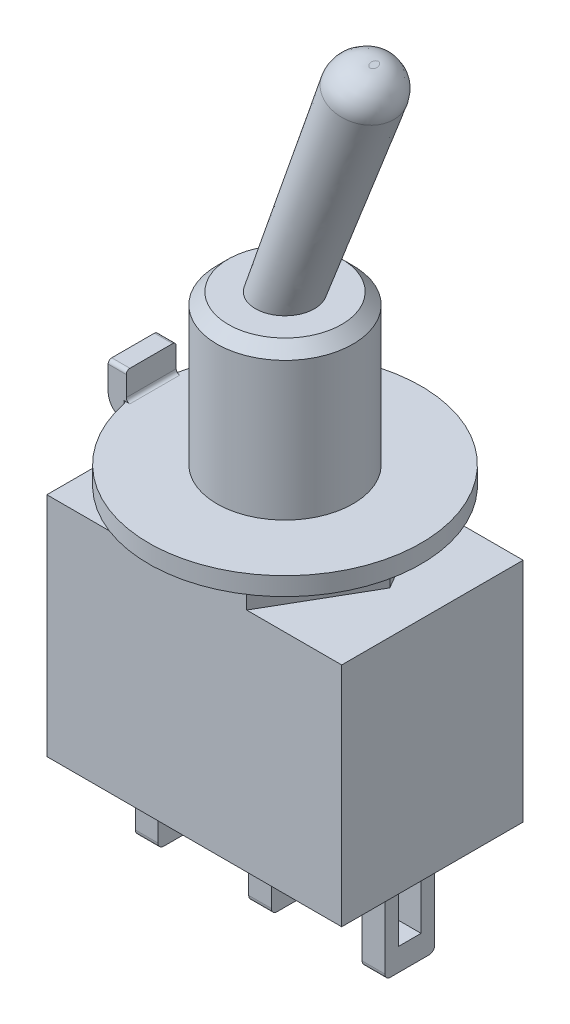
from build123d import *

# Parameters (mm, degrees)
SKETCH_1_W               = 13
SKETCH_1_H               = 8
EXTRUDE_1_DEPTH          = 10
SKETCH_2_W               = 1
SKETCH_2_H               = 2.2
EXTRUDE_2_DEPTH          = 4
FILLET_1_R               = 0.25
CUT_EXTRUDE_1_DEPTH      = 17.124515497
CUT_EXTRUDE_1_DEPTH_BACK = 17.124515497
SKETCH_3_W               = 1
SKETCH_3_H               = 2
SKETCH_4_R               = 3
EXTRUDE_3_DEPTH          = 9
SKETCH_5_R               = 3
EXTRUDE_4_DEPTH          = 1.6
CHAMFER_1_SIZE           = 0.5
EXTRUDE_5_DEPTH          = 0.8
SKETCH_7_W               = 0.8
SKETCH_7_H               = 2.2
EXTRUDE_6_DEPTH          = 1.2
FILLET_2_R               = 0.8
FILLET_3_R               = 0.16
FILLET_4_R               = 0.16
SKETCH_9_R               = 1.5
SKETCH_8_R               = 1.3
SKETCH_12_W              = 4.669738192
SKETCH_12_H              = 4.390198151
CUT_EXTRUDE_2_DEPTH      = 36.72966294
FILLET_5_R               = 1.25


with BuildPart() as part:
    # Эскиз1 → Бобышка-Вытянуть1 (new body)
    with BuildSketch(Plane(origin=(0, 0, 0), x_dir=(1, 0, 0), z_dir=(0, 1, 0))):
        Rectangle(SKETCH_1_W, SKETCH_1_H)
    extrude(amount=EXTRUDE_1_DEPTH)

    # Эскиз2 → Бобышка-Вытянуть2 (add)
    with BuildSketch(Plane.XZ):
        Rectangle(SKETCH_2_W, SKETCH_2_H)
        with Locations((-5, 0)):
            Rectangle(SKETCH_2_W, SKETCH_2_H)
        with Locations((5, 0)):
            Rectangle(SKETCH_2_W, SKETCH_2_H)
    extrude(amount=EXTRUDE_2_DEPTH)

    # Скругление1
    fillet_1_edges = [part.edges().sort_by_distance(p)[0] for p in [
        (-5, -4, 1.1),
        (-5, -4, -1.1),
        (0, -4, 1.1),
        (0, -4, -1.1),
        (5, -4, 1.1),
        (5, -4, -1.1),
    ]]
    fillet(fillet_1_edges, radius=FILLET_1_R)

    # Эскиз3 → Вырез-Вытянуть1 (cut, two sides: drawn at the far end of the back side and taken through both)
    with BuildSketch(Plane(origin=(5.5, 0, 0), x_dir=(0, 0, -1), z_dir=(1, 0, 0)).offset(-CUT_EXTRUDE_1_DEPTH_BACK)):
        with Locations((0, -2)):
            Rectangle(SKETCH_3_W, SKETCH_3_H)
    extrude(amount=CUT_EXTRUDE_1_DEPTH + CUT_EXTRUDE_1_DEPTH_BACK, mode=Mode.SUBTRACT)

    # Эскиз4 → Бобышка-Вытянуть3 (add)
    with BuildSketch(Plane(origin=(0, 10, 0), x_dir=(1, 0, 0), z_dir=(0, 1, 0))):
        with Locations(Location((0, 0, 0), (0, 0, 270))):
            Circle(SKETCH_4_R)
    extrude(amount=EXTRUDE_3_DEPTH)

    # Эскиз5 → Бобышка-Вытянуть4 (add)
    with BuildSketch(Plane(origin=(0, 10, 0), x_dir=(1, 0, 0), z_dir=(0, 1, 0))):
        Polygon((-4.618802154, 0), (-2.309401077, -4), (2.309401077, -4), (4.618802154, 0), (2.309401077, 4), (-2.309401077, 4), align=None)
        with Locations(Location((0, 0, 0), (0, 0, 270))):
            Circle(SKETCH_5_R, mode=Mode.SUBTRACT)
    extrude(amount=EXTRUDE_4_DEPTH)

    # Фаска1
    chamfer_1_edges = [part.edges().sort_by_distance(p)[0] for p in [
        (0, 19, -3),
    ]]
    chamfer(chamfer_1_edges, length=CHAMFER_1_SIZE)

    # Эскиз6 → Бобышка-Вытянуть5 (add)
    with BuildSketch(Plane(origin=(0, 11.6, 0), x_dir=(1, 0, 0), z_dir=(0, 1, 0))):
        with BuildLine():
            Line((-5.898304841, 1.1), (-6.698304841, 1.1))
            Line((-6.698304841, 1.1), (-6.698304841, -1.1))
            Line((-6.698304841, -1.1), (-5.898304841, -1.1))
            ThreePointArc((-5.898304841, -1.1), (6, 0), (-5.898304841, 1.1))
        make_face()
    extrude(amount=EXTRUDE_5_DEPTH)

    # Эскиз7 → Бобышка-Вытянуть6 (add)
    with BuildSketch(Plane(origin=(0, 12.4, 0), x_dir=(1, 0, 0), z_dir=(0, 1, 0))):
        with Locations((-6.298304841, 0)):
            Rectangle(SKETCH_7_W, SKETCH_7_H)
    extrude(amount=EXTRUDE_6_DEPTH)

    # Скругление2
    fillet_2_edges = [part.edges().sort_by_distance(p)[0] for p in [
        (-6.698304841, 11.6, 0),
    ]]
    fillet(fillet_2_edges, radius=FILLET_2_R)

    # Скругление3
    # the kernel refuses this fillet: 0.16 mm, written as the material it adds along each edge
    with BuildSketch(Plane(origin=(-5.898304841, 11.6, 1.1), x_dir=(0.19395072927353899, 0, 0.981011271400213), z_dir=(0, 1, 0))) as fillet_3_piece_1_section:
        with BuildLine():
            CenterArc((0.131466071, -0.159990649), FILLET_3_R, 90.619457051, 78.19710831)
            Line((-0.025495733, -0.128958532), (0, 0))
            ThreePointArc((0, 0), (0.064868127, -0.000350666), (0.129736254, 0))
        make_face()
    fillet_3_piece_1 = extrude(amount=0.8, mode=Mode.PRIVATE)
    fillet_3_piece_1 = split(fillet_3_piece_1, bisect_by=Plane(origin=(-5.898304841, 11.6, 1.1), z_dir=(1, 0, 0)), keep=Keep.TOP, mode=Mode.PRIVATE)
    add(fillet_3_piece_1)
    with BuildSketch(Plane(origin=(-5.898304841, 11.271363276, 1.1), x_dir=(0.19395072927353899, 0, 0.981011271400213), z_dir=(0, 1, 0))) as fillet_3_piece_2_section:
        with BuildLine():
            CenterArc((0.131466071, -0.159990649), FILLET_3_R, 90.619457051, 78.19710831)
            Line((-0.025495733, -0.128958532), (0, 0))
            ThreePointArc((0, 0), (0.064868127, -0.000350666), (0.129736254, 0))
        make_face()
    fillet_3_piece_2 = extrude(amount=1.128636724, mode=Mode.PRIVATE)
    fillet_3_piece_2 = fillet_3_piece_2 & Plane(origin=(-5.898304841, 12.4, 1.1), x_dir=(0, -1, 0), z_dir=(0, 0, 1)) * Cylinder(0.8, 3, mode=Mode.PRIVATE)
    add(fillet_3_piece_2)
    with BuildSketch(Plane(origin=(-5.898304841, 11.6, -1.1), x_dir=(0.19395072927353899, 0, -0.981011271400213), z_dir=(0, 1, 0))) as fillet_3_piece_3_section:
        with BuildLine():
            CenterArc((0.131466071, 0.159990649), FILLET_3_R, 191.18343464, 78.19710831)
            Line((-0.025495733, 0.128958532), (0, 0))
            ThreePointArc((0, 0), (0.064868127, 0.000350666), (0.129736254, 0))
        make_face()
    fillet_3_piece_3 = extrude(amount=0.8, mode=Mode.PRIVATE)
    fillet_3_piece_3 = split(fillet_3_piece_3, bisect_by=Plane(origin=(-5.898304841, 11.6, -1.1), z_dir=(1, 0, 0)), keep=Keep.TOP, mode=Mode.PRIVATE)
    add(fillet_3_piece_3)
    with BuildSketch(Plane(origin=(-5.898304841, 11.271363276, -1.1), x_dir=(0.19395072927353899, 0, -0.981011271400213), z_dir=(0, 1, 0))) as fillet_3_piece_4_section:
        with BuildLine():
            CenterArc((0.131466071, 0.159990649), FILLET_3_R, 191.18343464, 78.19710831)
            Line((-0.025495733, 0.128958532), (0, 0))
            ThreePointArc((0, 0), (0.064868127, 0.000350666), (0.129736254, 0))
        make_face()
    fillet_3_piece_4 = extrude(amount=1.128636724, mode=Mode.PRIVATE)
    fillet_3_piece_4 = fillet_3_piece_4 & Plane(origin=(-5.898304841, 12.4, -1.1), x_dir=(0, -1, 0), z_dir=(0, 0, 1)) * Cylinder(0.8, 3, mode=Mode.PRIVATE)
    add(fillet_3_piece_4)

    # Скругление4
    fillet_4_edges = [part.edges().sort_by_distance(p)[0] for p in [
        (-5.898304841, 12.4, 0),
        (-6.298304841, 13.6, 1.1),
        (-6.298304841, 13.6, -1.1),
    ]]
    fillet(fillet_4_edges, radius=FILLET_4_R)

    # Эскиз9 → По сечениям1 section 0
    with BuildSketch(Plane(origin=(0, 30, 0), x_dir=(1, 0, 0), z_dir=(0, 1, 0))):
        with Locations((4, 0.137410302)):
            Circle(SKETCH_9_R)
    # Эскиз8 → По сечениям1 section 1
    with BuildSketch(Plane(origin=(0, 19, 0), x_dir=(1, 0, 0), z_dir=(0, 1, 0))):
        Circle(SKETCH_8_R)
    loft()

    # Эскиз12 → Вырез-Вытянуть2 (cut, through all)
    with BuildSketch(Plane(origin=(2.5, 30, 0), x_dir=(0.939793423488437, -0.3417430630867046, 0), z_dir=(0.3417430630867046, 0.9397934234884371, 0))):
        with Locations((1.683707955, 0.058821328)):
            Rectangle(SKETCH_12_W, SKETCH_12_H)
    extrude(amount=CUT_EXTRUDE_2_DEPTH, mode=Mode.SUBTRACT)

    # Скругление5
    fillet_5_edges = [part.edges().sort_by_distance(p)[0] for p in [
        (3.814227677, 29.522099027, 1.359822242),
    ]]
    fillet(fillet_5_edges, radius=FILLET_5_R)


solid = part.part
